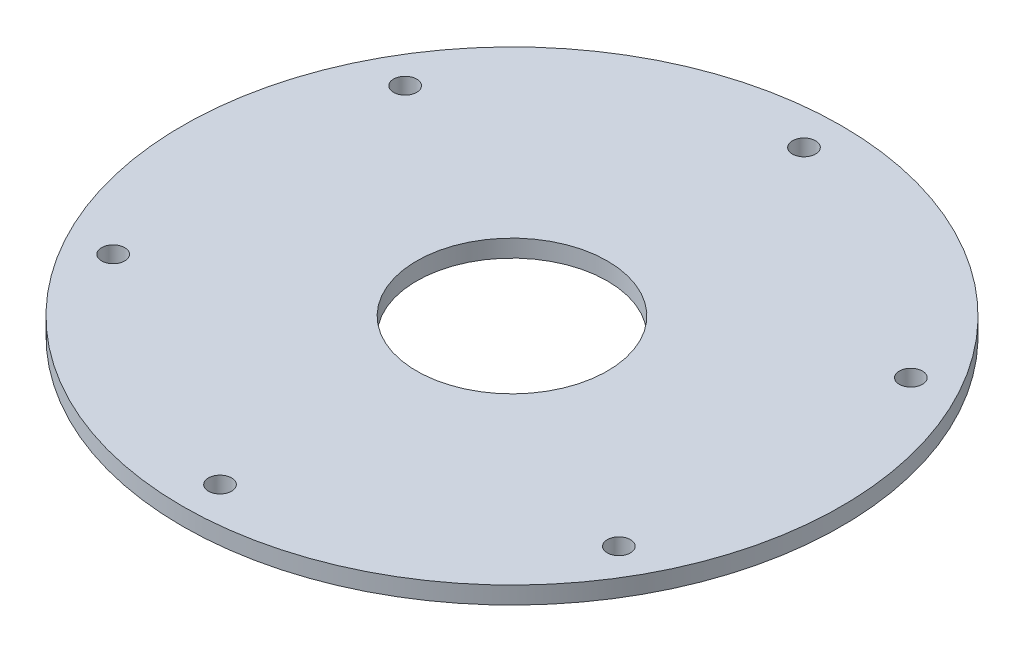
from build123d import *

# Parameters (mm, degrees)
SKETCH1_R           = 57
BOSS_EXTRUDE1_DEPTH = 3
SKETCH2_R           = 2
CUT_EXTRUDE1_DEPTH  = 81.665977958
CIRPATTERN1_COUNT   = 6
SKETCH4_R           = 16.5
CUT_EXTRUDE3_DEPTH  = 81.665977958


with BuildPart() as part:
    # Sketch1 → Boss-Extrude1 (new body)
    with BuildSketch(Plane(origin=(0, 0, 0), x_dir=(1, 0, 0), z_dir=(0, 1, 0))):
        Circle(SKETCH1_R)
    extrude(amount=BOSS_EXTRUDE1_DEPTH)

    # Sketch2 → Cut-Extrude1 (cut, through all)
    with BuildSketch(Plane(origin=(0, 3, 0), x_dir=(1, 0, 0), z_dir=(0, 1, 0))):
        with Locations((0, 50.5)):
            Circle(SKETCH2_R)
    cut_extrude1 = extrude(amount=-CUT_EXTRUDE1_DEPTH, mode=Mode.SUBTRACT)

    # CirPattern1: Cut-Extrude1 ×6 about axis
    cirpattern1_axis = Axis((0, 3, 0), (0, 1, 0))
    for i in range(1, CIRPATTERN1_COUNT):
        add(cut_extrude1.rotate(cirpattern1_axis, i * 360 / CIRPATTERN1_COUNT), mode=Mode.SUBTRACT)

    # Sketch4 → Cut-Extrude3 (cut, through all)
    with BuildSketch(Plane.XZ):
        Circle(SKETCH4_R)
    extrude(amount=-CUT_EXTRUDE3_DEPTH, mode=Mode.SUBTRACT)


solid = part.part
